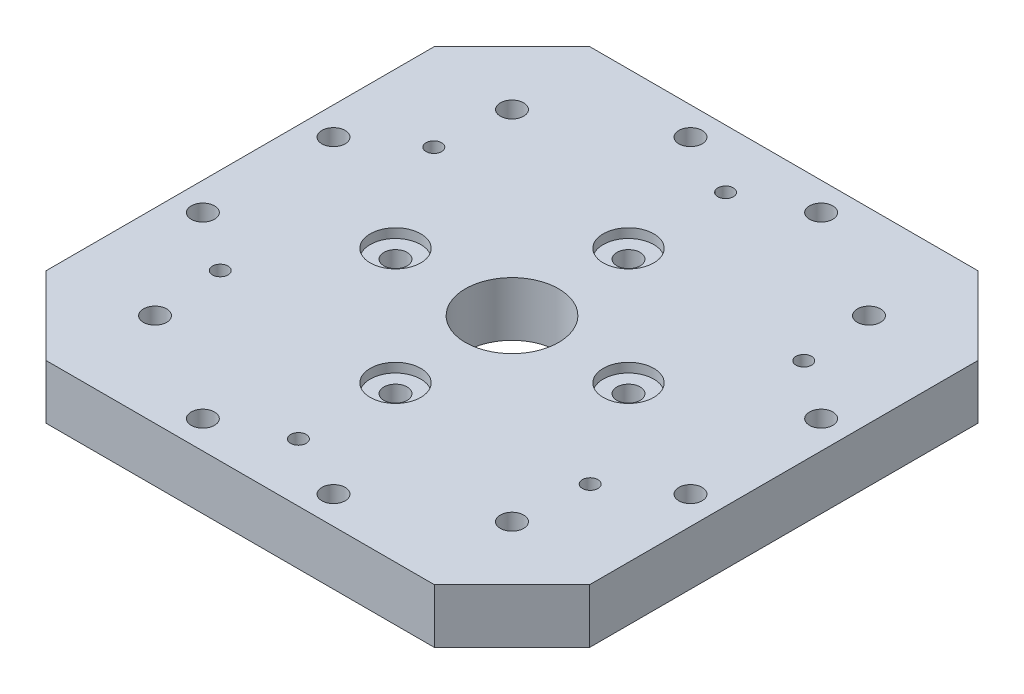
from build123d import *

# Parameters (mm, degrees)
SKETCH1_W           = 70
SKETCH1_H           = 70
SKETCH1_R           = 6
SKETCH1_R_2         = 1.5
SKETCH1_R_3         = 1
BOSS_EXTRUDE1_DEPTH = 7
SKETCH2_R           = 3.25
CUT_EXTRUDE1_DEPTH  = 1.2
CHAMFER1_SIZE       = 10


with BuildPart() as part:
    # Sketch1 → Boss-Extrude1 (new body)
    with BuildSketch(Plane(origin=(0, 0, 0), x_dir=(1, 0, 0), z_dir=(0, 1, 0))):
        Rectangle(SKETCH1_W, SKETCH1_H)
        Circle(SKETCH1_R, mode=Mode.SUBTRACT)
        with Locations((0, 15)):
            Circle(SKETCH1_R_2, mode=Mode.SUBTRACT)
        with Locations((15, 0)):
            Circle(SKETCH1_R_2, mode=Mode.SUBTRACT)
        with Locations((0, -15)):
            Circle(SKETCH1_R_2, mode=Mode.SUBTRACT)
        with Locations((-15, 0)):
            Circle(SKETCH1_R_2, mode=Mode.SUBTRACT)
        with Locations((-31.392589354, -8.411618966)):
            Circle(SKETCH1_R_2, mode=Mode.SUBTRACT)
        with Locations((-31.392589354, 8.411618966)):
            Circle(SKETCH1_R_2, mode=Mode.SUBTRACT)
        with Locations((-22.980970389, 22.980970389)):
            Circle(SKETCH1_R_2, mode=Mode.SUBTRACT)
        with Locations((-8.411618966, 31.392589354)):
            Circle(SKETCH1_R_2, mode=Mode.SUBTRACT)
        with Locations((8.411618966, 31.392589354)):
            Circle(SKETCH1_R_2, mode=Mode.SUBTRACT)
        with Locations((22.980970389, 22.980970389)):
            Circle(SKETCH1_R_2, mode=Mode.SUBTRACT)
        with Locations((31.392589354, 8.411618966)):
            Circle(SKETCH1_R_2, mode=Mode.SUBTRACT)
        with Locations((31.392589354, -8.411618966)):
            Circle(SKETCH1_R_2, mode=Mode.SUBTRACT)
        with Locations((22.980970389, -22.980970389)):
            Circle(SKETCH1_R_2, mode=Mode.SUBTRACT)
        with Locations((8.411618966, -31.392589354)):
            Circle(SKETCH1_R_2, mode=Mode.SUBTRACT)
        with Locations((-8.411618966, -31.392589354)):
            Circle(SKETCH1_R_2, mode=Mode.SUBTRACT)
        with Locations((-22.980970389, -22.980970389)):
            Circle(SKETCH1_R_2, mode=Mode.SUBTRACT)
        with Locations((0, 27.5)):
            Circle(SKETCH1_R_3, mode=Mode.SUBTRACT)
        with Locations((23.815698604, 13.75)):
            Circle(SKETCH1_R_3, mode=Mode.SUBTRACT)
        with Locations((23.815698604, -13.75)):
            Circle(SKETCH1_R_3, mode=Mode.SUBTRACT)
        with Locations((0, -27.5)):
            Circle(SKETCH1_R_3, mode=Mode.SUBTRACT)
        with Locations((-23.815698604, -13.75)):
            Circle(SKETCH1_R_3, mode=Mode.SUBTRACT)
        with Locations((-23.815698604, 13.75)):
            Circle(SKETCH1_R_3, mode=Mode.SUBTRACT)
    extrude(amount=BOSS_EXTRUDE1_DEPTH)

    # Sketch2 → Cut-Extrude1 (cut)
    with BuildSketch(Plane(origin=(0, 7, 0), x_dir=(1, 0, 0), z_dir=(0, 1, 0))):
        with Locations((0, 15)):
            Circle(SKETCH2_R)
        with Locations((15, 0)):
            Circle(SKETCH2_R)
        with Locations((0, -15)):
            Circle(SKETCH2_R)
        with Locations((-15, 0)):
            Circle(SKETCH2_R)
    extrude(amount=-CUT_EXTRUDE1_DEPTH, mode=Mode.SUBTRACT)

    # Chamfer1
    chamfer1_edges = [part.edges().sort_by_distance(p)[0] for p in [
        (-35, 3.5, -35),
        (35, 3.5, -35),
        (35, 3.5, 35),
        (-35, 3.5, 35),
    ]]
    chamfer(chamfer1_edges, length=CHAMFER1_SIZE)


solid = part.part
